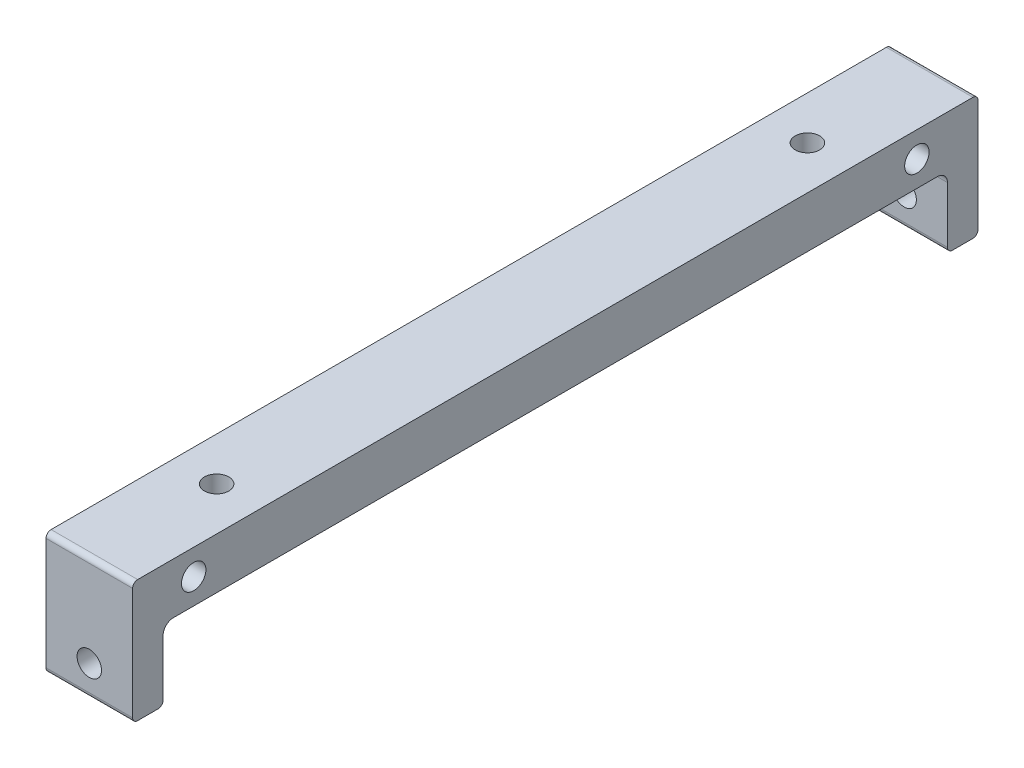
from build123d import *

# Parameters (mm, degrees)
SKETCH1_W           = 8.5
SKETCH1_H           = 12
BOSS_EXTRUDE1_DEPTH = 41.5
CUT_EXTRUDE1_DEPTH  = 43.784342931
FILLET1_R           = 0.5
M2_HOLE1_J_D        = 2.4
M2_HOLE1_J_DEPTH    = 5
M2_HOLE1_J_TIP      = 0.721032743
M2_HOLE2_K_D        = 2.4
M2_HOLE2_K_DEPTH    = 5
M2_HOLE2_K_TIP      = 0.721032743
M2_HOLE3_L_D        = 2.4
M2_HOLE3_L_DEPTH    = 10
M2_HOLE3_L_TIP      = 0.721032743
M2_HOLE4_M_D        = 2.4
M2_HOLE5_N_D        = 2.4
M2_HOLE5_N_DEPTH    = 4
M2_HOLE5_N_TIP      = 0.721032743
M2_HOLE6_P_D        = 2.4
M2_HOLE6_P_DEPTH    = 10
M2_HOLE6_P_TIP      = 0.721032743


with BuildPart() as part:
    # Sketch1 → Boss-Extrude1 (new, symmetric)
    with BuildSketch(Plane.XY):
        Rectangle(SKETCH1_W, SKETCH1_H)
    extrude(amount=BOSS_EXTRUDE1_DEPTH, both=True)

    # Sketch2 → Cut-Extrude1 (cut, through all)
    with BuildSketch(Plane(origin=(4.25, 0, 0), x_dir=(0, 0, -1), z_dir=(1, 0, 0))):
        with BuildLine():
            Line((-37.5, 1), (37.5, 1))
            ThreePointArc((37.5, 1), (38.207106781, 0.707106781), (38.5, 0))
            Line((38.5, 0), (38.5, -6))
            Line((38.5, -6), (-38.5, -6))
            Line((-38.5, -6), (-38.5, 0))
            ThreePointArc((-38.5, 0), (-38.207106781, 0.707106781), (-37.5, 1))
        make_face()
    extrude(amount=-CUT_EXTRUDE1_DEPTH, mode=Mode.SUBTRACT)

    # Fillet1
    fillet1_edges = [part.edges().sort_by_distance(p)[0] for p in [
        (0, 6, -41.5),
        (0, 6, 41.5),
        (0, -6, -41.5),
        (0, -6, -38.5),
        (0, -6, 38.5),
        (0, -6, 41.5),
    ]]
    fillet(fillet1_edges, radius=FILLET1_R)

    # M2 Hole1-J
    with Locations(Plane(origin=(4.25, 0, 0), x_dir=(0, 0, -1), z_dir=(1, 0, 0))):
        with Locations((-35.5, 3.5), (35.5, 3.5)):
            Hole(M2_HOLE1_J_D / 2, depth=M2_HOLE1_J_DEPTH)
            with Locations((0, 0, -(M2_HOLE1_J_DEPTH + M2_HOLE1_J_TIP / 2))):  # 118° drill point
                Cone(0, M2_HOLE1_J_D / 2, M2_HOLE1_J_TIP, mode=Mode.SUBTRACT)

    # M2 Hole2-K
    with Locations(Plane.ZY.offset(4.25)):
        with Locations((-21.5, 3.5), (21.5, 3.5)):
            Hole(M2_HOLE2_K_D / 2, depth=M2_HOLE2_K_DEPTH)
            with Locations((0, 0, -(M2_HOLE2_K_DEPTH + M2_HOLE2_K_TIP / 2))):  # 118° drill point
                Cone(0, M2_HOLE2_K_D / 2, M2_HOLE2_K_TIP, mode=Mode.SUBTRACT)

    # M2 Hole3-L
    with Locations(Plane.XY.offset(41.5)):
        with Locations((0, -3)):
            Hole(M2_HOLE3_L_D / 2, depth=M2_HOLE3_L_DEPTH)
            with Locations((0, 0, -(M2_HOLE3_L_DEPTH + M2_HOLE3_L_TIP / 2))):  # 118° drill point
                Cone(0, M2_HOLE3_L_D / 2, M2_HOLE3_L_TIP, mode=Mode.SUBTRACT)

    # M2 Hole4-M (through all)
    with Locations(Plane(origin=(0, 6, 0), x_dir=(1, 0, 0), z_dir=(0, 1, 0))):
        with Locations((0, 29), (0, -29)):
            Hole(M2_HOLE4_M_D / 2)

    # M2 Hole5-N
    with Locations(Plane.ZY.offset(4.25)):
        with Locations((0, 3.5)):
            Hole(M2_HOLE5_N_D / 2, depth=M2_HOLE5_N_DEPTH)
            with Locations((0, 0, -(M2_HOLE5_N_DEPTH + M2_HOLE5_N_TIP / 2))):  # 118° drill point
                Cone(0, M2_HOLE5_N_D / 2, M2_HOLE5_N_TIP, mode=Mode.SUBTRACT)

    # M2 Hole6-P
    with Locations(Plane(origin=(0, 0, -41.5), x_dir=(-1, 0, 0), z_dir=(0, 0, -1))):
        with Locations((0, -3)):
            Hole(M2_HOLE6_P_D / 2, depth=M2_HOLE6_P_DEPTH)
            with Locations((0, 0, -(M2_HOLE6_P_DEPTH + M2_HOLE6_P_TIP / 2))):  # 118° drill point
                Cone(0, M2_HOLE6_P_D / 2, M2_HOLE6_P_TIP, mode=Mode.SUBTRACT)


solid = part.part
